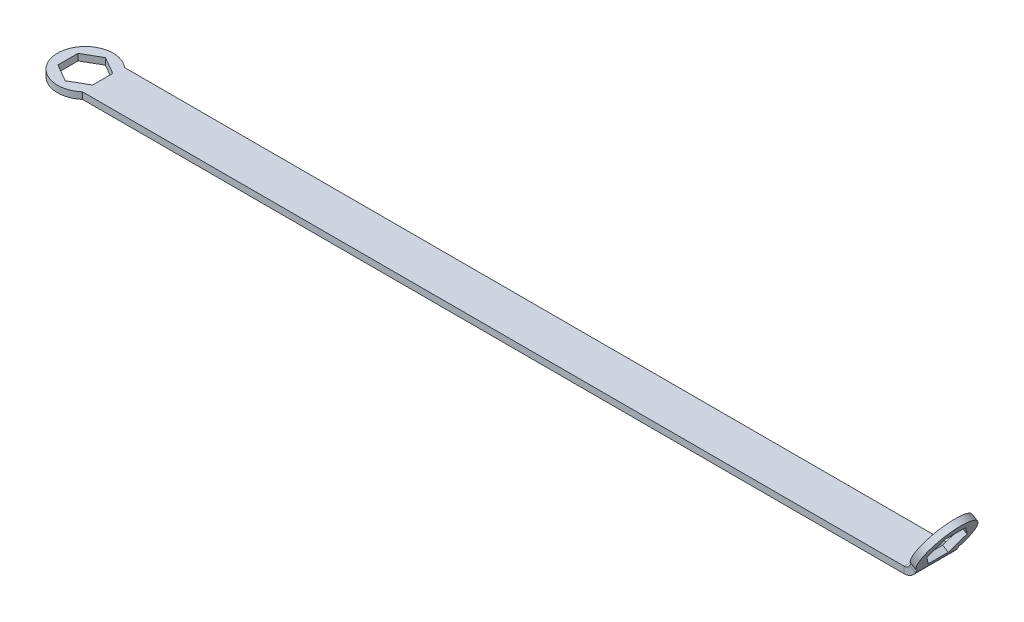
from build123d import *

# Parameters (mm, degrees)
SKETCH1_W              = 190.5125
SKETCH1_H              = 9.6
BOSS_EXTRUDE1_DEPTH    = 0.75
SKETCHED_START         = 85.719592776
SKETCHED_BEND1_DEPTH   = 7.280407224
SKETCHED_START_2       = -7
SKETCHED_BEND1_2_DEPTH = 14
SKETCHED_START_3       = -6.35
SKETCHED_BEND1_3_DEPTH = 4.058641119
SKETCHED_START_4       = 2.291358881
SKETCHED_BEND1_4_DEPTH = 4.058641119
SKETCHED_START_5       = -3.11420605
SKETCHED_BEND1_5_DEPTH = 6.2284121
SKETCHED_START_6       = 81.780241505
SKETCHED_BEND1_6_DEPTH = 10.219758495
SKETCHED_START_7       = 79
SKETCHED_BEND1_7_DEPTH = 2.780241505
SKETCHED_START_8       = 80.280241505
SKETCHED_BEND1_8_DEPTH = 1.5


with BuildPart() as part:
    # Sketch1 → Boss-Extrude1 (new, symmetric)
    # profile 1 of 3: a face of its own
    with BuildSketch(Plane(origin=(0, 0, 0), x_dir=(1, 0, 0), z_dir=(0, 1, 0))):
        with BuildLine():
            Line((-95.25625, 4.8), (-95.25625, -4.8))
            ThreePointArc((-95.25625, -4.8), (-105.763472631, 0), (-95.25625, 4.8))
        make_face()
        Polygon((-103.382222631, -2.291358881), (-99.413472631, -4.582717762), (-95.444722631, -2.291358881), (-95.444722631, 2.291358881), (-99.413472631, 4.582717762), (-103.382222631, 2.291358881), align=None, mode=Mode.SUBTRACT)
    # profile 2 of 3: a face of its own
    with BuildSketch(Plane(origin=(0, 0, 0), x_dir=(1, 0, 0), z_dir=(0, 1, 0))):
        Rectangle(SKETCH1_W, SKETCH1_H)
    # profile 3 of 3: a face of its own
    with BuildSketch(Plane(origin=(0, 0, 0), x_dir=(1, 0, 0), z_dir=(0, 1, 0))):
        with BuildLine():
            Line((95.25625, 4.8), (95.25625, -4.8))
            ThreePointArc((95.25625, -4.8), (105.763472631, 0), (95.25625, 4.8))
        make_face()
        Polygon((95.444722631, -2.291358881), (99.413472631, -4.582717762), (103.382222631, -2.291358881), (103.382222631, 2.291358881), (99.413472631, 4.582717762), (95.444722631, 2.291358881), align=None, mode=Mode.SUBTRACT)
    extrude(amount=BOSS_EXTRUDE1_DEPTH, both=True)

    # Sketched Bend1: read off the stored shape, not the designer's step
    # Sketched Bend1 outline → Sketched Bend1 (cut)
    with BuildSketch(Plane(origin=(0, 0, 0), x_dir=(0.49999999999999767, 0.86602540378444, 0), z_dir=(0.8660254037844399, -0.49999999999999795, 0)).offset(SKETCHED_START)):
        Polygon((48.903772606, 2.291358881), (48.903772606, -2.291358881), (52.872522606, -4.582717762), (56.841272606, -2.291358881), (56.841272606, 2.291358881), (52.872522606, 4.582717762), align=None)
    extrude(amount=SKETCHED_BEND1_DEPTH, mode=Mode.SUBTRACT)

    # Sketched Bend1 2 outline → Sketched Bend1 2 (cut)
    with BuildSketch(Plane.XY.offset(SKETCHED_START_2)):
        with BuildLine():
            Line((95.444722631, 0.75), (94.864701597, 0.75))
            ThreePointArc((94.864701597, 0.75), (93.766625385, -0.348076211), (92.266625385, -0.75))
            Line((92.266625385, -0.75), (95.444722631, -0.75))
            Line((95.444722631, -0.75), (95.444722631, 0.75))
        make_face()
    extrude(amount=SKETCHED_BEND1_2_DEPTH, mode=Mode.SUBTRACT)

    # Sketched Bend1 3 outline → Sketched Bend1 3 (add)
    with BuildSketch(Plane.XY.offset(SKETCHED_START_3)):
        with BuildLine():
            Line((99.244402974, 8.335865308), (97.945364869, 9.085865308))
            Line((97.945364869, 9.085865308), (93.565663491, 1.5))
            ThreePointArc((93.565663491, 1.5), (93.016625385, 0.950961894), (92.266625385, 0.75))
            Line((92.266625385, 0.75), (94.864701597, 0.75))
            Line((94.864701597, 0.75), (99.244402974, 8.335865308))
        make_face()
    extrude(amount=SKETCHED_BEND1_3_DEPTH)

    # Sketched Bend1 4 outline → Sketched Bend1 4 (add)
    with BuildSketch(Plane.XY.offset(SKETCHED_START_4)):
        with BuildLine():
            Line((99.244402974, 8.335865308), (97.945364869, 9.085865308))
            Line((97.945364869, 9.085865308), (93.565663491, 1.5))
            ThreePointArc((93.565663491, 1.5), (93.016625385, 0.950961894), (92.266625385, 0.75))
            Line((92.266625385, 0.75), (94.864701597, 0.75))
            Line((94.864701597, 0.75), (99.244402974, 8.335865308))
        make_face()
    extrude(amount=SKETCHED_BEND1_4_DEPTH)

    # Sketched Bend1 5 outline → Sketched Bend1 5 (add)
    with BuildSketch(Plane.XY.offset(SKETCHED_START_5)):
        with BuildLine():
            Line((94.864701597, 0.75), (95.275652974, 1.461788665))
            Line((95.275652974, 1.461788665), (93.976614869, 2.211788665))
            Line((93.976614869, 2.211788665), (93.565663491, 1.5))
            ThreePointArc((93.565663491, 1.5), (93.016625385, 0.950961894), (92.266625385, 0.75))
            Line((92.266625385, 0.75), (94.864701597, 0.75))
        make_face()
    extrude(amount=SKETCHED_BEND1_5_DEPTH)

    # Sketched Bend1 6 outline → Sketched Bend1 6 (cut)
    with BuildSketch(Plane(origin=(0, 0, 0), x_dir=(0.49999999999999767, 0.86602540378444, 0), z_dir=(0.8660254037844399, -0.49999999999999795, 0)).offset(SKETCHED_START_6)):
        with BuildLine():
            Line((48.903772606, -2.29135888), (45, -0.037514714))
            Line((45, -0.037514714), (45, -6.35))
            Line((45, -6.35), (52.872522564, -6.35))
            ThreePointArc((52.872522564, -6.35), (54.047030124, -6.240435248), (55.181007092, -5.915521902))
            Line((55.181007092, -5.915521902), (52.872522606, -4.582717762))
            Line((52.872522606, -4.582717762), (48.903772606, -2.29135888))
        make_face()
        with BuildLine():
            Line((45, 0.037514714), (48.903772606, 2.29135888))
            Line((48.903772606, 2.29135888), (52.872522606, 4.582717762))
            Line((52.872522606, 4.582717762), (55.181007092, 5.915521902))
            ThreePointArc((55.181007092, 5.915521902), (54.047030182, 6.240435237), (52.872522681, 6.35))
            Line((52.872522681, 6.35), (45, 6.35))
            Line((45, 6.35), (45, 0.037514714))
        make_face()
    extrude(amount=SKETCHED_BEND1_6_DEPTH, mode=Mode.SUBTRACT)

    # Sketched Bend1 7 outline → Sketched Bend1 7 (cut)
    with BuildSketch(Plane(origin=(0, 0, 0), x_dir=(0.49999999999999767, 0.86602540378444, 0), z_dir=(0.8660254037844399, -0.49999999999999795, 0)).offset(SKETCHED_START_7)):
        Polygon((56.841272607, -2.291358881), (48.903772606, -2.291358881), (52.872522606, -4.582717762), align=None)
        Polygon((48.903772606, 2.291358881), (56.841272607, 2.291358881), (52.872522606, 4.582717762), align=None)
        with BuildLine():
            Line((56.841272606, -6.35), (56.841272606, -4.956967161))
            ThreePointArc((56.841272606, -4.956967161), (54.975586842, -5.991629229), (52.872522564, -6.35))
            Line((52.872522564, -6.35), (56.841272606, -6.35))
        make_face()
        with BuildLine():
            Line((48.715299976, -4.8), (45, -4.8))
            Line((45, -4.8), (45, -6.35))
            Line((45, -6.35), (52.872522564, -6.35))
            ThreePointArc((52.872522564, -6.35), (50.654133531, -5.949894949), (48.715299976, -4.8))
        make_face()
        with BuildLine():
            Line((56.841272606, 4.956967161), (56.841272606, 6.35))
            Line((56.841272606, 6.35), (52.872522681, 6.35))
            ThreePointArc((52.872522681, 6.35), (54.975586897, 5.99162921), (56.841272606, 4.956967161))
        make_face()
        with BuildLine():
            Line((45, 6.35), (45, 4.8))
            Line((45, 4.8), (48.715299976, 4.8))
            ThreePointArc((48.715299976, 4.8), (50.654133586, 5.94989497), (52.872522681, 6.35))
            Line((52.872522681, 6.35), (45, 6.35))
        make_face()
    extrude(amount=SKETCHED_BEND1_7_DEPTH, mode=Mode.SUBTRACT)

    # Sketched Bend1 8 outline → Sketched Bend1 8 (add)
    with BuildSketch(Plane(origin=(0, 0, 0), x_dir=(0.49999999999999767, 0.86602540378444, 0), z_dir=(0.8660254037844399, -0.49999999999999795, 0)).offset(SKETCHED_START_8)):
        with BuildLine():
            Line((56.841272606, 4.956967161), (56.841272606, -4.956967161))
            ThreePointArc((56.841272606, -4.956967161), (59.222522606, 0), (56.841272606, 4.956967161))
        make_face()
    extrude(amount=SKETCHED_BEND1_8_DEPTH)


solid = part.part
